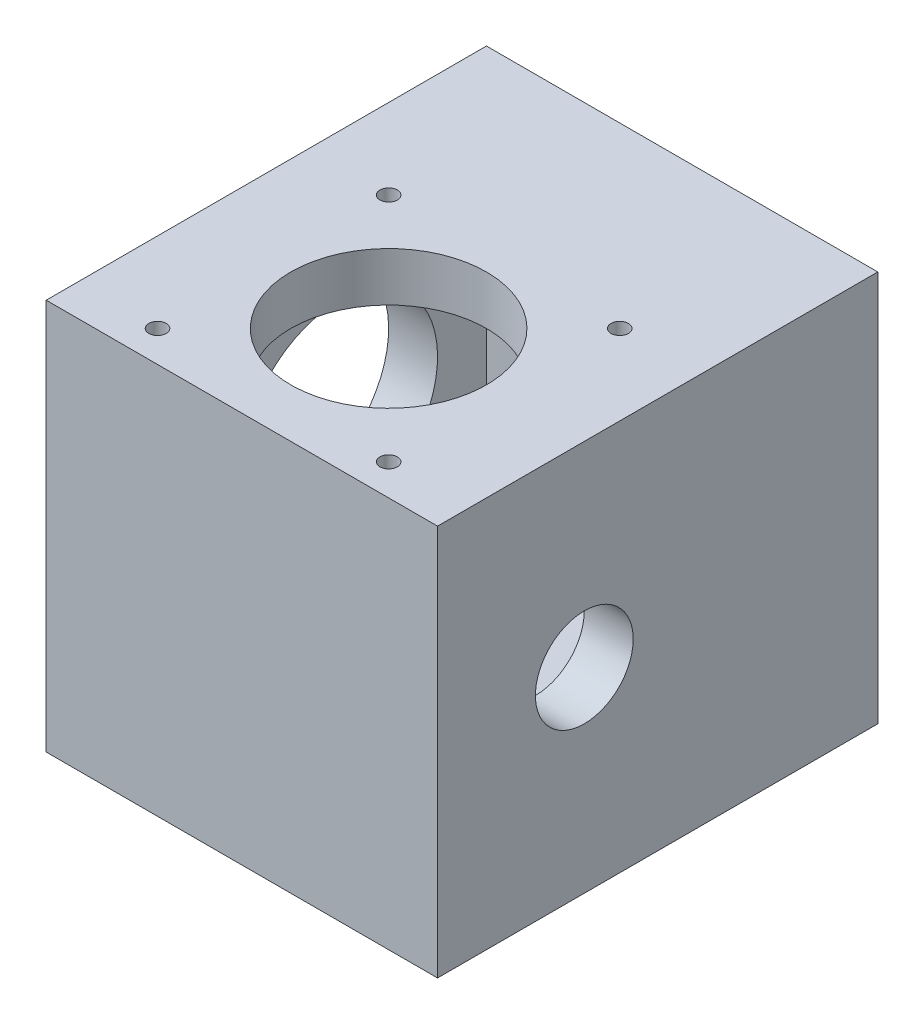
from build123d import *

# Parameters (mm, degrees)
SKETCH1_W                                = 50.8
SKETCH1_H                                = 50.8
BOSS_EXTRUDE1_DEPTH                      = 57.15
CUT_EXTRUDE2_START                       = 6.35
SKETCH3_W                                = 38.1
SKETCH3_H                                = 38.1
CUT_EXTRUDE2_DEPTH                       = 44.45
SKETCH5_R                                = 12.7
CUT_EXTRUDE3_DEPTH                       = 6.35
SKETCH6_R                                = 12.7
CUT_EXTRUDE4_DEPTH                       = 6.35
SKETCH7_R                                = 6.35
CUT_EXTRUDE5_DEPTH                       = 6.35
F_3_8_0_375_CLEARANCE_DOWEL_HOLE1_REACH  = 70.392
F_3_8_0_375_CLEARANCE_DOWEL_HOLE1_BORE_R = 6.35
TAP_DRILL_FOR_4_40_TAP1_REACH            = 82.572
TAP_DRILL_FOR_4_40_TAP1_BORE_R           = 1.1303
TAP_START                                = 19.05
TAP_DRILL_FOR_4_40_TAP2_OUTLINE_R        = 1.1303
TAP_DRILL_FOR_4_40_TAP2_DEPTH            = 6.35


# Read off the part's stored shape, not the designer's step: Tap Drill for #4-40 Tap2
with BuildPart() as part:
    # Sketch1 → Boss-Extrude1 (new body)
    with BuildSketch(Plane.XY):
        Rectangle(SKETCH1_W, SKETCH1_H)
    extrude(amount=BOSS_EXTRUDE1_DEPTH)

    # Sketch3 → Cut-Extrude2 (cut)
    with BuildSketch(Plane.XY.offset(CUT_EXTRUDE2_START)):
        Rectangle(SKETCH3_W, SKETCH3_H)
    extrude(amount=CUT_EXTRUDE2_DEPTH, mode=Mode.SUBTRACT)

    # Sketch5 → Cut-Extrude3 (cut)
    with BuildSketch(Plane.ZY.offset(25.4)):
        with Locations(Location((25.4, 0, 0), (0, 0, 270))):
            Circle(SKETCH5_R)
    extrude(amount=-CUT_EXTRUDE3_DEPTH, mode=Mode.SUBTRACT)

    # Sketch6 → Cut-Extrude4 (cut)
    with BuildSketch(Plane(origin=(0, 25.4, 0), x_dir=(1, 0, 0), z_dir=(0, 1, 0))):
        with Locations(Location((0, -38.1, 0), (0, 0, 180))):
            Circle(SKETCH6_R)
    extrude(amount=-CUT_EXTRUDE4_DEPTH, mode=Mode.SUBTRACT)

    # Sketch7 → Cut-Extrude5 (cut)
    with BuildSketch(Plane.XZ.offset(25.4)):
        with Locations((0, 31.75)):
            Circle(SKETCH7_R)
    extrude(amount=-CUT_EXTRUDE5_DEPTH, mode=Mode.SUBTRACT)

    # 3/8 (0.375) Clearance Dowel Hole1 bore (on position points) → 3/8 (0.375) Clearance Dowel Hole1 (cut, up to next)
    with BuildSketch(Plane(origin=(25.4, 0, 38.1), x_dir=(0, 0, 1), z_dir=(1, 0, 0)), mode=Mode.PRIVATE) as f_3_8_0_375_clearance_dowel_hole1_sk1:
        Circle(F_3_8_0_375_CLEARANCE_DOWEL_HOLE1_BORE_R)
    f_3_8_0_375_clearance_dowel_hole1_tool1 = extrude(f_3_8_0_375_clearance_dowel_hole1_sk1.sketch, amount=-F_3_8_0_375_CLEARANCE_DOWEL_HOLE1_REACH, mode=Mode.PRIVATE) & part.part
    add(f_3_8_0_375_clearance_dowel_hole1_tool1.solids().sort_by_distance((25.4, 0, 38.1))[0], mode=Mode.SUBTRACT)

    # Tap Drill for #4-40 Tap1 bore → Tap Drill for #4-40 Tap1 (cut, up to next)
    with BuildSketch(Plane.ZY.offset(25.4), mode=Mode.PRIVATE) as tap_drill_for_4_40_tap1_sk1:
        with Locations((10.4, -15)):
            Circle(TAP_DRILL_FOR_4_40_TAP1_BORE_R)
    tap_drill_for_4_40_tap1_tool1 = extrude(tap_drill_for_4_40_tap1_sk1.sketch, amount=-TAP_DRILL_FOR_4_40_TAP1_REACH, mode=Mode.PRIVATE) & part.part
    # Tap Drill for #4-40 Tap1 bore → Tap Drill for #4-40 Tap1 (cut, up to next)
    with BuildSketch(Plane.ZY.offset(25.4), mode=Mode.PRIVATE) as tap_drill_for_4_40_tap1_sk2:
        with Locations((10.4, 15)):
            Circle(TAP_DRILL_FOR_4_40_TAP1_BORE_R)
    tap_drill_for_4_40_tap1_tool2 = extrude(tap_drill_for_4_40_tap1_sk2.sketch, amount=-TAP_DRILL_FOR_4_40_TAP1_REACH, mode=Mode.PRIVATE) & part.part
    # Tap Drill for #4-40 Tap1 bore → Tap Drill for #4-40 Tap1 (cut, up to next)
    with BuildSketch(Plane.ZY.offset(25.4), mode=Mode.PRIVATE) as tap_drill_for_4_40_tap1_sk3:
        with Locations((40.4, 15)):
            Circle(TAP_DRILL_FOR_4_40_TAP1_BORE_R)
    tap_drill_for_4_40_tap1_tool3 = extrude(tap_drill_for_4_40_tap1_sk3.sketch, amount=-TAP_DRILL_FOR_4_40_TAP1_REACH, mode=Mode.PRIVATE) & part.part
    # Tap Drill for #4-40 Tap1 bore → Tap Drill for #4-40 Tap1 (cut, up to next)
    with BuildSketch(Plane.ZY.offset(25.4), mode=Mode.PRIVATE) as tap_drill_for_4_40_tap1_sk4:
        with Locations((40.4, -15)):
            Circle(TAP_DRILL_FOR_4_40_TAP1_BORE_R)
    tap_drill_for_4_40_tap1_tool4 = extrude(tap_drill_for_4_40_tap1_sk4.sketch, amount=-TAP_DRILL_FOR_4_40_TAP1_REACH, mode=Mode.PRIVATE) & part.part
    add(tap_drill_for_4_40_tap1_tool1.solids().sort_by_distance((-25.4, -15, 10.4))[0], mode=Mode.SUBTRACT)
    add(tap_drill_for_4_40_tap1_tool2.solids().sort_by_distance((-25.4, 15, 10.4))[0], mode=Mode.SUBTRACT)
    add(tap_drill_for_4_40_tap1_tool3.solids().sort_by_distance((-25.4, 15, 40.4))[0], mode=Mode.SUBTRACT)
    add(tap_drill_for_4_40_tap1_tool4.solids().sort_by_distance((-25.4, -15, 40.4))[0], mode=Mode.SUBTRACT)

    # Tap Drill for #4-40 Tap2 outline → Tap Drill for #4-40 Tap2 (cut)
    with BuildSketch(Plane(origin=(0, 0, 0), x_dir=(1, 0, 0), z_dir=(0, 1, 0)).offset(TAP_START)):
        with Locations((-15, -53.1)):
            Circle(TAP_DRILL_FOR_4_40_TAP2_OUTLINE_R)
        with Locations((15, -53.1)):
            Circle(TAP_DRILL_FOR_4_40_TAP2_OUTLINE_R)
        with Locations((15, -23.1)):
            Circle(TAP_DRILL_FOR_4_40_TAP2_OUTLINE_R)
        with Locations((-15, -23.1)):
            Circle(TAP_DRILL_FOR_4_40_TAP2_OUTLINE_R)
    extrude(amount=TAP_DRILL_FOR_4_40_TAP2_DEPTH, mode=Mode.SUBTRACT)


solid = part.part
